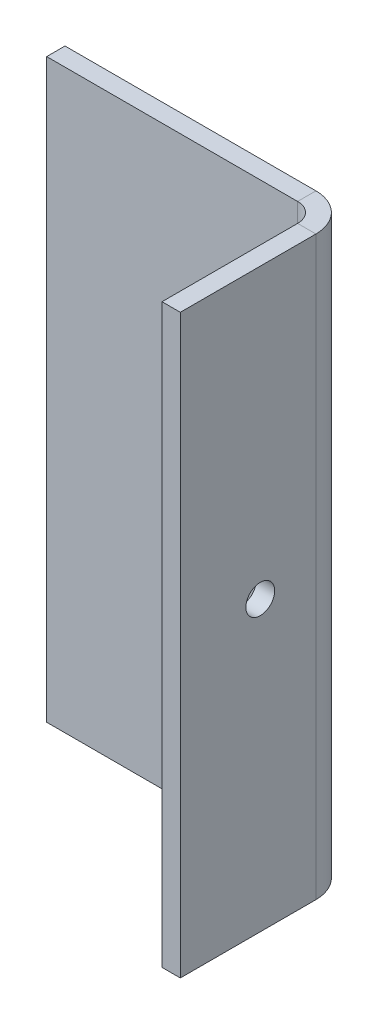
from build123d import *

# Parameters (mm, degrees)
SKETCH1_W                    = 50
SKETCH1_H                    = 100
BASE_FLANGE2_DEPTH           = 3.175
EDGE_FLANGE1_STRIP_W         = 19.304
EDGE_FLANGE1_STRIP_H         = 3.175
EDGE_FLANGE1_STRIP_CUT_DEPTH = 100
EDGE_FLANGE1_DEPTH           = 100
F_5_0MM_DOWEL_HOLE1_D        = 5


# Sheet-metal steps are written as plain solids
with BuildPart() as part:
    # Sketch1 → Base-Flange2 (new body)
    with BuildSketch(Plane.XY):
        Rectangle(SKETCH1_W, SKETCH1_H)
    extrude(amount=-BASE_FLANGE2_DEPTH)

    # Edge-Flange1 strip (across the edge) → Edge-Flange1 strip cut (cut)
    with BuildSketch(Plane(origin=(25, -50, 0), x_dir=(-1, 0, 0), z_dir=(0, 1, 0))):
        with Locations((-3.175, -1.5875)):
            Rectangle(EDGE_FLANGE1_STRIP_W, EDGE_FLANGE1_STRIP_H)
    extrude(amount=EDGE_FLANGE1_STRIP_CUT_DEPTH, mode=Mode.SUBTRACT)

    # Edge-Flange1 section (across the edge) → Edge-Flange1 (add)
    with BuildSketch(Plane(origin=(25, -50, 0), x_dir=(-1, 0, 0), z_dir=(0, 1, 0))):
        with BuildLine():
            Line((0, 3.302), (0, 26.825))
            Line((0, 26.825), (3.175, 26.825))
            Line((3.175, 26.825), (3.175, 3.302))
            ThreePointArc((3.175, 3.302), (4.142133409, 0.967133409), (6.477, 0))
            Line((6.477, 0), (6.477, -3.175))
            ThreePointArc((6.477, -3.175), (1.897069378, -1.277930622), (0, 3.302))
        make_face()
    extrude(amount=EDGE_FLANGE1_DEPTH)

    # Ø5.0mm Dowel Hole1 (through all)
    with Locations(Plane(origin=(25, 0, 0), x_dir=(0, 0, -1), z_dir=(1, 0, 0))):
        with Locations((-12.954, 0)):
            Hole(F_5_0MM_DOWEL_HOLE1_D / 2)


solid = part.part
